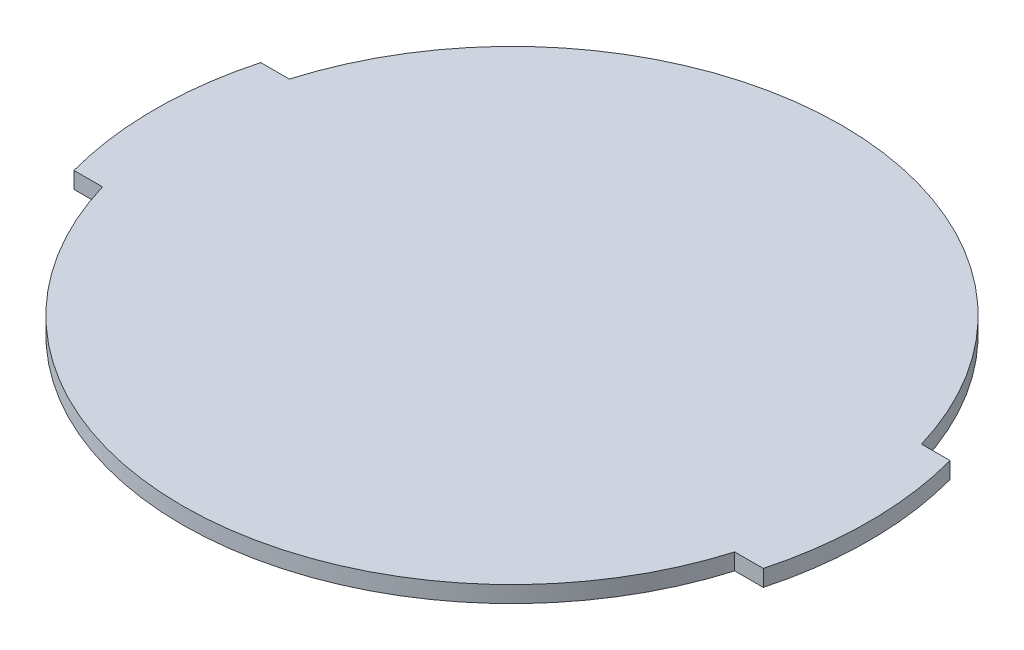
from build123d import *

# Parameters (mm, degrees)
BOSS_EXTRUDE1_DEPTH = 3


with BuildPart() as part:
    # Sketch1 → Boss-Extrude1 (new body)
    with BuildSketch(Plane(origin=(0, 0, 0), x_dir=(1, 0, 0), z_dir=(0, 1, 0))):
        with BuildLine():
            Line((-62.737548565, -17), (-57.541289523, -17))
            ThreePointArc((-57.541289523, -17), (0, -60), (57.541289523, -17))
            Line((57.541289523, -17), (62.737548565, -17))
            ThreePointArc((62.737548565, -17), (65, 0), (62.737548565, 17))
            Line((62.737548565, 17), (57.541289523, 17))
            ThreePointArc((57.541289523, 17), (0, 60), (-57.541289523, 17))
            Line((-57.541289523, 17), (-62.737548565, 17))
            ThreePointArc((-62.737548565, 17), (-65, 0), (-62.737548565, -17))
        make_face()
    extrude(amount=BOSS_EXTRUDE1_DEPTH)


solid = part.part
